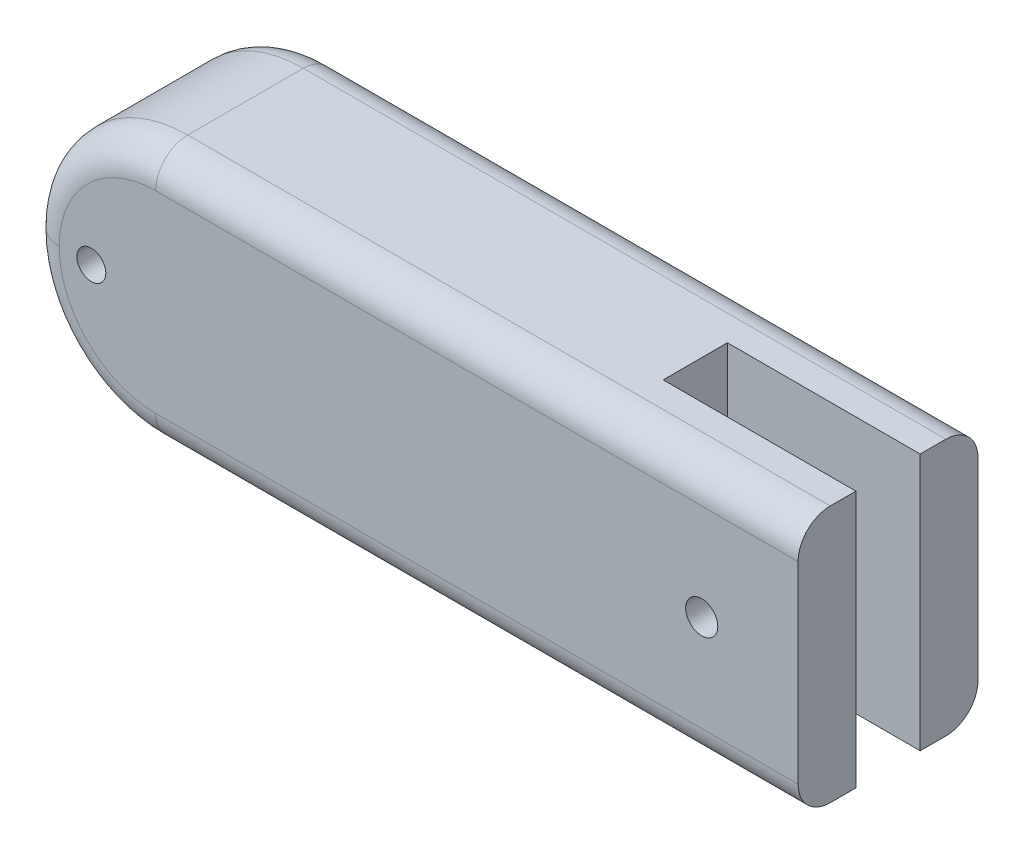
from build123d import *

# Parameters (mm, degrees)
ESBO_O1_W                = 120
ESBO_O1_H                = 40
ESBO_O1_R                = 2.25
RESSALTO_EXTRUS_O1_DEPTH = 28
ESBO_O2_W                = 10
ESBO_O2_H                = 40
CORTE_EXTRUS_O1_DEPTH    = 30
FILETE1_R                = 20
FILETE2_R                = 5
ESBO_O3_R                = 2.5
CORTE_EXTRUS_O2_DEPTH    = 40


with BuildPart() as part:
    # Esboço1 → Ressalto-extrusão1 (new body)
    with BuildSketch(Plane.XY):
        with Locations((60, 20)):
            Rectangle(ESBO_O1_W, ESBO_O1_H)
        with Locations((10, 20)):
            Circle(ESBO_O1_R, mode=Mode.SUBTRACT)
    extrude(amount=RESSALTO_EXTRUS_O1_DEPTH)

    # Esboço2 → Corte-extrusão1 (cut)
    with BuildSketch(Plane(origin=(120, 0, 0), x_dir=(0, 0, -1), z_dir=(1, 0, 0))):
        with Locations((-14, 20)):
            Rectangle(ESBO_O2_W, ESBO_O2_H)
    extrude(amount=-CORTE_EXTRUS_O1_DEPTH, mode=Mode.SUBTRACT)

    # Filete1
    filete1_edges = [part.edges().sort_by_distance(p)[0] for p in [
        (0, 0, 14),
        (0, 40, 14),
    ]]
    fillet(filete1_edges, radius=FILETE1_R - 0.0001)  # a hair under: the kernel refuses the full size

    # Filete2
    filete2_edges = [part.edges().sort_by_distance(p)[0] for p in [
        (69.99995, 40, 28),
        (69.99995, 0, 28),
        (69.99995, 0, 0),
        (5.857835087, 34.142164913, 0),
        (5.857835087, 5.857835087, 0),
        (5.857835087, 34.142164913, 28),
        (5.857835087, 5.857835087, 28),
        (69.99995, 40, 0),
    ]]
    fillet(filete2_edges, radius=FILETE2_R)

    # Esboço3 → Corte-extrusão2 (cut)
    with BuildSketch(Plane.XY.offset(28)):
        with Locations((105, 20)):
            Circle(ESBO_O3_R)
    extrude(amount=-CORTE_EXTRUS_O2_DEPTH, mode=Mode.SUBTRACT)


solid = part.part
